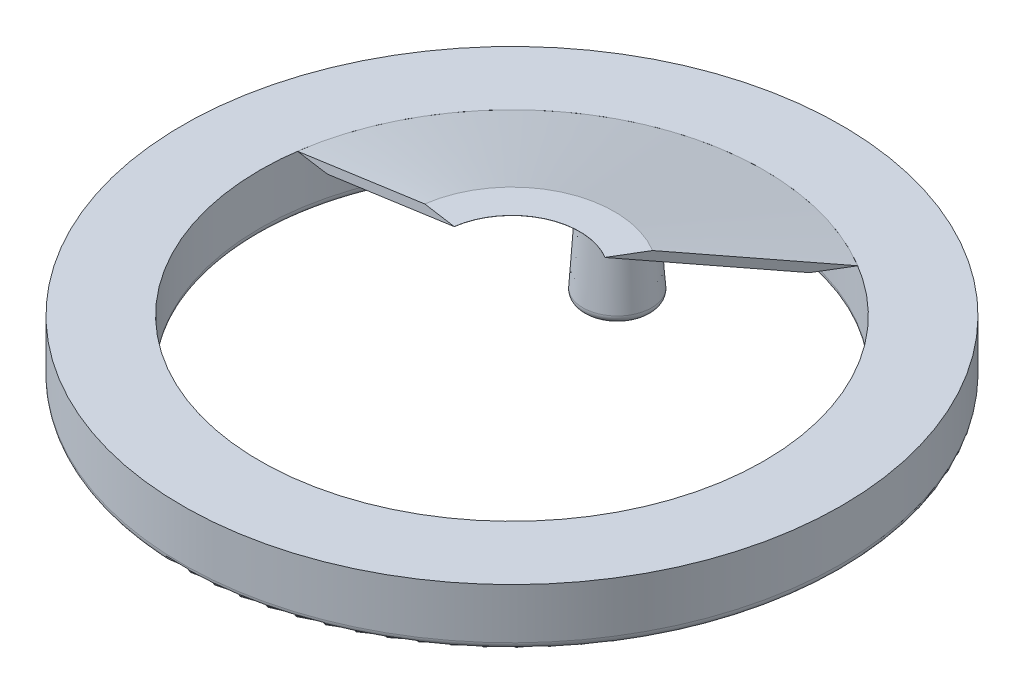
from build123d import *

# Parameters (mm, degrees)
SKETCH1_W                 = 960
SKETCH1_H                 = 450
BOSS_EXTRUDE1_DEPTH       = 118
BOSS_EXTRUDE10_DEPTH      = 10
BOSS_EXTRUDE15_DEPTH      = 30
SWEEP1_PROFILE_R          = 5
SKETCH39_R                = 10
BOSS_EXTRUDE17_DEPTH      = 30
BOSS_EXTRUDE17_DRAFT      = -6
SKETCH290_R               = 48
BOSS_EXTRUDE33_DEPTH      = 10
SKETCH291_R               = 25
CUT_EXTRUDE18_START       = -255
CUT_EXTRUDE18_OUTLINE_R   = 21.000000142
CUT_EXTRUDE18_DEPTH       = 20
BOSS_EXTRUDE34_START      = 10
SKETCH294_R               = 24.999996895
SKETCH294_R_2             = 21.000000142
BOSS_EXTRUDE34_DEPTH      = 10
SKETCH295_R               = 17.5
BOSS_EXTRUDE35_DEPTH      = 40
SKETCH298_R               = 85
SKETCH298_R_2             = 65
BOSS_EXTRUDE36_DEPTH      = 15
REVOLVE2_ANGLE            = 82
REVOLVE2_OTHER_WAY_ANGLE  = 31
SKETCH301_R               = 7
SKETCH302_R               = 9
SKETCH348_R               = 7.85
BOSS_EXTRUDE39_DEPTH      = 25.7
SKETCH349_R               = 25
BOSS_EXTRUDE40_DEPTH      = 20
SKETCH351_R               = 7.85
BOSS_EXTRUDE41_DEPTH      = 25.7
SKETCH353_R               = 25
BOSS_EXTRUDE42_DEPTH      = 20
SKETCH359_W               = 176
SKETCH359_H               = 100
BOSS_EXTRUDE44_DEPTH      = 3
SKETCH360_R               = 15
SKETCH360_R_2             = 20
BOSS_EXTRUDE46_DEPTH      = 8
SKETCH361_R               = 20
BOSS_EXTRUDE47_DEPTH      = 8
SKETCH368_W               = 153
SKETCH368_H               = 100
BOSS_EXTRUDE48_DEPTH      = 3
SKETCH409_W               = 87.321701038
SKETCH409_H               = 70.377876338
CUT_EXTRUDE21_DEPTH       = 202
BOSS_EXTRUDE51_DEPTH      = 8.5
SKETCH417_W               = 25
SKETCH417_H               = 43
BOSS_EXTRUDE52_DEPTH      = 21.3
SKETCH418_W               = 31.239129338
SKETCH418_H               = 19
BOSS_EXTRUDE53_DEPTH      = 7.5
SWEEP4_PROFILE_R          = 5
BOSS_EXTRUDE54_DEPTH      = 450
BOSS_EXTRUDE55_DEPTH      = 450
BOSS_EXTRUDE55_2_DEPTH    = 450
BOSS_EXTRUDE56_DEPTH      = 8
BOSS_EXTRUDE57_DEPTH      = 12
BOSS_EXTRUDE58_DEPTH      = 40
BOSS_EXTRUDE58_DEPTH_BACK = 40
SKETCH523_W               = 30
SKETCH523_H               = 450
SKETCH528_R               = 8
CUT_EXTRUDE23_DEPTH       = 505
CUT_EXTRUDE24_DEPTH       = 31
SKETCH531_R               = 12.5
CUT_EXTRUDE25_DEPTH       = 91
SKETCH532_R               = 9
BOSS_EXTRUDE59_DEPTH      = 11
BOSS_EXTRUDE59_TAPER      = 13
SWEEP5_PROFILE_R          = 3
SKETCH548_R               = 3.822526848
BOSS_EXTRUDE60_DEPTH      = 11
BOSS_EXTRUDE60_DRAFT      = -4
BOSS_EXTRUDE61_DEPTH      = 450
BOSS_EXTRUDE62_DEPTH      = 20
SKETCH574_W               = 6
SKETCH574_H               = 6.933046309
BOSS_EXTRUDE63_DEPTH      = 20
CUT_EXTRUDE26_DEPTH       = 10
SKETCH576_R               = 3.3489074
CUT_EXTRUDE27_DEPTH       = 5
CUT_EXTRUDE28_DEPTH       = 2
BOSS_EXTRUDE64_DEPTH      = 40
BOSS_EXTRUDE64_DEPTH_BACK = 50
SKETCH578_W               = 30
SKETCH578_H               = 450
SKETCH579_R               = 8
CUT_EXTRUDE29_DEPTH       = 458
SKETCH580_R               = 9
BOSS_EXTRUDE65_DEPTH      = 12
BOSS_EXTRUDE65_TAPER      = 9
SWEEP6_PROFILE_R          = 3
SKETCH624_R               = 4
BOSS_EXTRUDE66_DEPTH      = 12
BOSS_EXTRUDE66_DRAFT      = -6
BOSS_EXTRUDE67_DEPTH      = 35
BOSS_EXTRUDE68_DEPTH      = 35
CUT_EXTRUDE31_DEPTH       = 43
CUT_EXTRUDE32_DEPTH       = 600
FILLET1_R                 = 2
FILLET2_R                 = 2


# Read off the part's stored shape, not the designer's step: Boss-Extrude15, Cut-Extrude18
with BuildPart() as part:
    # Sketch1 → Boss-Extrude1 (new body)
    with BuildSketch(Plane.XY):
        Rectangle(SKETCH1_W, SKETCH1_H)
    extrude(amount=BOSS_EXTRUDE1_DEPTH)

    # Sketch27 → Boss-Extrude10 (add)
    with BuildSketch(Plane.XZ.offset(225)):
        with BuildLine():
            Line((-358.776190415, 0), (-290.379824208, 0))
            ThreePointArc((-290.379824208, 0), (-324.578007312, 52.886171467), (-358.776190415, 0))
        make_face()
    extrude(amount=BOSS_EXTRUDE10_DEPTH)

    # Sketch290 → Boss-Extrude33 (add)
    with BuildSketch(Plane.XZ.offset(225)):
        with Locations(Location((412, 58, 0), (0, 0, 90))):
            Circle(SKETCH290_R)
    extrude(amount=BOSS_EXTRUDE33_DEPTH)

    # Sketch291 → section 1 of loft2
    with BuildSketch(Plane(origin=(0, -255, 0), x_dir=(-1, 0, 0), z_dir=(0, -1, 0)), mode=Mode.PRIVATE) as loft2_s1:
        with Locations((-412, -58)):
            Circle(SKETCH291_R)
    # loft from a face of the part (loft2)
    loft([part.faces().sort_by_distance((412, -235, 58))[0], loft2_s1.sketch])

    # Cut-Extrude18 outline → Cut-Extrude18 (cut)
    with BuildSketch(Plane(origin=(0, 0, 0), x_dir=(1, 0, 0), z_dir=(0, 1, 0)).offset(CUT_EXTRUDE18_START)):
        with Locations((412.000003105, -57.99999986)):
            Circle(CUT_EXTRUDE18_OUTLINE_R)
    extrude(amount=CUT_EXTRUDE18_DEPTH, mode=Mode.SUBTRACT)

    # Sketch294 → Boss-Extrude34 (add)
    with BuildSketch(Plane.XZ.offset(255).offset(BOSS_EXTRUDE34_START)):
        with Locations(Location((412.000003105, 57.99999986, 0), (0, 0, 90.000007115))):
            Circle(SKETCH294_R)
        with Locations(Location((412.000003105, 57.99999986, 0), (0, 0, 270))):
            Circle(SKETCH294_R_2, mode=Mode.SUBTRACT)
    extrude(amount=-BOSS_EXTRUDE34_DEPTH)

    # Sketch295 → Boss-Extrude35 (add)
    with BuildSketch(Plane.XZ.offset(235)):
        with Locations(Location((412.000003105, 57.99999986, 0), (0, 0, 90))):
            Circle(SKETCH295_R)
    extrude(amount=BOSS_EXTRUDE35_DEPTH)

    # Sketch299 → Revolve2 (revolve)
    with BuildSketch(Plane(origin=(412, 0, 0), x_dir=(0, 0, -1), z_dir=(1, 0, 0))):
        Polygon((-2.030561419, -285), (-40.49999986, -275.023695571), (-40.49999986, -272.681794182), (7.00000014, -285), align=None)
    revolve(axis=Axis((412.000003105, -275, 57.99999986), (0, 1, 0)), revolution_arc=REVOLVE2_ANGLE)

    # Sketch299 → Revolve2 other way (revolve)
    with BuildSketch(Plane(origin=(412, 0, 0), x_dir=(0, 0, -1), z_dir=(1, 0, 0))):
        Polygon((-2.030561419, -285), (-40.49999986, -275.023695571), (-40.49999986, -272.681794182), (7.00000014, -285), align=None)
    revolve(axis=Axis((412.000003105, -275, 57.99999986), (0, -1, 0)), revolution_arc=REVOLVE2_OTHER_WAY_ANGLE)

    # Sketch348 → Boss-Extrude39 (add)
    with BuildSketch(Plane.XZ.offset(225)):
        with Locations(Location((260, 93, 0), (0, 0, 90))):
            Circle(SKETCH348_R)
    extrude(amount=BOSS_EXTRUDE39_DEPTH)

    # Sketch349 → Boss-Extrude40 (add)
    with BuildSketch(Plane.XZ.offset(250.7)):
        with Locations(Location((260, 93, 0), (0, 0, 270))):
            Circle(SKETCH349_R)
    extrude(amount=BOSS_EXTRUDE40_DEPTH)

    # Sketch351 → Boss-Extrude41 (add)
    with BuildSketch(Plane(origin=(-410.149510752, -225, -12.966274107), x_dir=(1, 0, 0), z_dir=(0, -1, 0))):
        with Locations(Location((201.149510752, 105.966274107, 0), (0, 0, 90))):
            Circle(SKETCH351_R)
    extrude(amount=BOSS_EXTRUDE41_DEPTH)

    # Sketch353 → Boss-Extrude42 (add)
    with BuildSketch(Plane(origin=(-410.149510752, -250.7, -12.966274107), x_dir=(1, 0, 0), z_dir=(0, -1, 0))):
        with Locations(Location((201.149510752, 105.966274107, 0), (0, 0, 270))):
            Circle(SKETCH353_R)
    extrude(amount=BOSS_EXTRUDE42_DEPTH)

    # Sketch359 → Boss-Extrude44 (add)
    with BuildSketch(Plane.XZ.offset(225)):
        with Locations((157, 50)):
            Rectangle(SKETCH359_W, SKETCH359_H)
    extrude(amount=BOSS_EXTRUDE44_DEPTH)

    # Sketch360 → Boss-Extrude46 (add)
    with BuildSketch(Plane.XZ.offset(228)):
        with Locations(Location((200, 45, 0), (0, 0, 90))):
            Circle(SKETCH360_R)
        with Locations(Location((157, 45, 0), (0, 0, 90))):
            Circle(SKETCH360_R)
        with Locations(Location((112, 45, 0), (0, 0, 90))):
            Circle(SKETCH360_R_2)
    extrude(amount=BOSS_EXTRUDE46_DEPTH)

    # Sketch361 → Boss-Extrude47 (add)
    with BuildSketch(Plane.XZ.offset(236)):
        with Locations(Location((112, 45, 0), (0, 0, 90))):
            Circle(SKETCH361_R)
    extrude(amount=BOSS_EXTRUDE47_DEPTH)

    # Sketch368 → Boss-Extrude48 (add)
    with BuildSketch(Plane.XZ.offset(225)):
        with Locations((-22.5, 50)):
            Rectangle(SKETCH368_W, SKETCH368_H)
    extrude(amount=BOSS_EXTRUDE48_DEPTH)


with BuildPart() as body_2:
    # Boss-Extrude15 outline → Boss-Extrude15 (new body)
    with BuildSketch(Plane.XZ.offset(235)):
        with BuildLine():
            Line((-339.578007312, 0), (-309.578007312, 0))
            Line((-309.578007312, 0), (-309.578007312, 49.755489179))
            ThreePointArc((-309.578007312, 49.755489179), (-324.578007312, 52.886171467), (-339.578007312, 49.755489179))
            Line((-339.578007312, 49.755489179), (-339.578007312, 0))
        make_face()
    extrude(amount=BOSS_EXTRUDE15_DEPTH)


with BuildPart() as body_3:
    # Sweep1: sweep along a path in Sketch30
    with BuildLine(Plane(origin=(-324.578007312, 0, 0), x_dir=(0, 0, -1), z_dir=(1, 0, 0))) as sweep1_path:
        Line((-70.098528038, -245), (-166.691110666, -270.88190451))
    # Sweep1 profile (on start of the path) → Sweep1 (sweep)
    with BuildSketch(Plane(origin=(-324.578007312, -245, 70.098528038), x_dir=(0, 0.9659258262890672, 0.25881904510252496), z_dir=(0, -0.25881904510252496, 0.9659258262890672))):
        Circle(SWEEP1_PROFILE_R)
    sweep(path=sweep1_path.line)


with BuildPart() as body_4:
    # Sketch39 → Boss-Extrude17 (with draft: the straight prism first)
    with BuildSketch(Plane(origin=(0, -59.818424556, 223.245399672), x_dir=(1, 0, 0), z_dir=(0, -0.25881904510252496, 0.9659258262890672))):
        with Locations((-324.578007312, -218.508993351)):
            Circle(SKETCH39_R)
    extrude(amount=-BOSS_EXTRUDE17_DEPTH)
    # Boss-Extrude17: the draft: its side faces are tilted about the plane it starts from
    boss_extrude17_sides = [body_4.faces().sort_by_distance(p)[0] for p in [
        (-334.578007312, -266.999618834, 152.202223272),
    ]]
    draft(boss_extrude17_sides, Plane(origin=(0, -59.818424556, 223.245399672), x_dir=(1, 0, 0), z_dir=(0, -0.25881904510252496, 0.9659258262890672)), BOSS_EXTRUDE17_DRAFT)


with BuildPart() as body_5:
    # Sketch298 → Boss-Extrude36 (new body)
    with BuildSketch(Plane(origin=(0, -285, 0), x_dir=(-1, 0, 0), z_dir=(0, -1, 0))):
        with Locations(Location((-412.000003105, -57.99999986, 0), (0, 0, 180))):
            Circle(SKETCH298_R)
        with Locations(Location((-412.000003105, -57.99999986, 0), (0, 0, 180))):
            Circle(SKETCH298_R_2, mode=Mode.SUBTRACT)
    extrude(amount=BOSS_EXTRUDE36_DEPTH)

    # Fillet2
    fillet2_edges = [body_5.edges().sort_by_distance(p)[0] for p in [
        (327.000003105, -300, 57.99999986),
        (347.000003105, -300, 57.99999986),
    ]]
    fillet(fillet2_edges, radius=FILLET2_R)


with BuildPart() as body_6:
    # Sketch301 → Loft3 section 0
    with BuildSketch(Plane.XZ.offset(300)):
        with Locations((375.04379433, -6.111142955)):
            Circle(SKETCH301_R)
    # Sketch302 → Loft3 section 1
    with BuildSketch(Plane(origin=(0, -331.5, 0), x_dir=(-1, 0, 0), z_dir=(0, -1, 0))):
        with Locations((-375.04379433, 6.111142955)):
            Circle(SKETCH302_R)
    loft()

    # Fillet1
    fillet1_edges = [body_6.edges().sort_by_distance(p)[0] for p in [
        (366.04379433, -331.5, -6.111142955),
        (368.04379433, -300, -6.111142955),
    ]]
    fillet(fillet1_edges, radius=FILLET1_R)


with BuildPart() as cut_extrude21_tool:
    # Sketch409 → Cut-Extrude21 (new body)
    with BuildSketch(Plane(origin=(0, 0, 0), x_dir=(-1, 0, 0), z_dir=(0, 0, -1))):
        with Locations((319.57579901, -260.188938169)):
            Rectangle(SKETCH409_W, SKETCH409_H)
    extrude(amount=-CUT_EXTRUDE21_DEPTH)


with BuildPart() as part_1:
    add(part.part)

    # Cut-Extrude21: cut by cut_extrude21_tool
    add(cut_extrude21_tool.part, mode=Mode.SUBTRACT)

    # Sketch416 → Boss-Extrude51 (add)
    with BuildSketch(Plane.XZ.offset(225)):
        with BuildLine():
            Line((-187.333898684, 0), (-120.666101316, 0))
            ThreePointArc((-120.666101316, 0), (-154, 54.678509787), (-187.333898684, 0))
        make_face()
    extrude(amount=BOSS_EXTRUDE51_DEPTH)

    # Sketch417 → Boss-Extrude52 (add)
    with BuildSketch(Plane(origin=(0, -233.5, 0), x_dir=(-1, 0, 0), z_dir=(0, -1, 0))):
        with Locations((154, -23.5)):
            Rectangle(SKETCH417_W, SKETCH417_H)
    extrude(amount=BOSS_EXTRUDE52_DEPTH)

    # Sketch418 → Boss-Extrude53 (add)
    with BuildSketch(Plane(origin=(-141.5, 0, 0), x_dir=(0, 0, -1), z_dir=(1, 0, 0))):
        with Locations((-19.120957381, -243)):
            Rectangle(SKETCH418_W, SKETCH418_H)
    boss_extrude53 = extrude(amount=BOSS_EXTRUDE53_DEPTH)

    # Mirror11: Boss-Extrude53 across plane
    add(boss_extrude53.mirror(Plane(origin=(-154, 0, 0), x_dir=(0, 0, 1), z_dir=(1, 0, 0))))

    # Sweep4: sweep along a path in Sketch419
    with BuildLine(Plane(origin=(-154, 0, 0), x_dir=(0, 0, -1), z_dir=(1, 0, 0))) as sweep4_path:
        Line((-40.004640895, -239.861739097), (-94.16906731, -249.412388869))
    # Sweep4 profile (on start of the path) → Sweep4 (sweep)
    with BuildSketch(Plane(origin=(-154, -239.861739097, 40.004640895), x_dir=(0, 0.9848077530122079, 0.17364817766693108), z_dir=(0, -0.17364817766693108, 0.9848077530122079))):
        Circle(SWEEP4_PROFILE_R)
    sweep(path=sweep4_path.line)


with BuildPart() as body_2_1:
    add(body_2.part)

    # Cut-Extrude21: cut by cut_extrude21_tool
    add(cut_extrude21_tool.part, mode=Mode.SUBTRACT)


with BuildPart() as body_3_1:
    add(body_3.part)

    # Cut-Extrude21: cut by cut_extrude21_tool
    add(cut_extrude21_tool.part, mode=Mode.SUBTRACT)


with BuildPart() as body_4_1:
    add(body_4.part)

    # Cut-Extrude21: cut by cut_extrude21_tool
    add(cut_extrude21_tool.part, mode=Mode.SUBTRACT)


with BuildPart() as body_4_2:
    # Sketch46 → Boss-Extrude54 (new body)
    with BuildSketch(Plane(origin=(0, 225, 0), x_dir=(1, 0, 0), z_dir=(0, 1, 0))):
        Polygon((-309, 134), (-309, 20), (309, 20), (309, 134), (259, 134), (259, 104), (174, 104), (174, 58), (54, 58), (54, 104), (-54, 104), (-54, 88), (-174, 88), (-174, 104), (-259, 104), (-259, 134), align=None)
    extrude(amount=-BOSS_EXTRUDE54_DEPTH)

    # Sketch530 → Cut-Extrude24 (cut)
    with BuildSketch(Plane(origin=(309, 0, 0), x_dir=(0, 0, -1), z_dir=(1, 0, 0))):
        with BuildLine():
            Line((111, -30), (111, 30))
            ThreePointArc((111, 30), (113.928932188, 37.071067812), (121, 40))
            Line((121, 40), (134, 40))
            Line((134, 40), (134, -40))
            Line((134, -40), (121, -40))
            ThreePointArc((121, -40), (113.928932188, -37.071067812), (111, -30))
        make_face()
    cut_extrude24 = extrude(amount=-CUT_EXTRUDE24_DEPTH, mode=Mode.SUBTRACT)

    # Sketch531 → Cut-Extrude25 (cut)
    with BuildSketch(Plane(origin=(309, 0, 0), x_dir=(0, 0, -1), z_dir=(1, 0, 0))):
        with Locations((61, 0)):
            Circle(SKETCH531_R)
    cut_extrude25 = extrude(amount=-CUT_EXTRUDE25_DEPTH, mode=Mode.SUBTRACT)


with BuildPart() as body_5_2:
    # Sketch507 → Boss-Extrude55 (new body)
    with BuildSketch(Plane.XZ.offset(225)):
        Polygon((245.334467639, 0), (245.334467639, -12), (255.334467639, -12), (255.334467639, -20), (309, -20), (309, -11.290670978), (270.334467639, -4.4728944), (260.334467639, -4.4728944), (260.334467639, 0), align=None)
    extrude(amount=-BOSS_EXTRUDE55_DEPTH)


with BuildPart() as body_6_2:
    # Sketch507 → Boss-Extrude55 2 (new body)
    with BuildSketch(Plane.XZ.offset(225)):
        Polygon((-260.334467639, -4.4728944), (-260.334467639, 0), (-245.334467639, 0), (-245.334467639, -12), (-255.334467639, -12), (-255.334467639, -20), (-309, -20), (-309, -11.290670978), (-270.334467639, -4.4728944), align=None)
    extrude(amount=-BOSS_EXTRUDE55_2_DEPTH)


with BuildPart() as body_7:
    # Sketch508 → Boss-Extrude56 (new body)
    with BuildSketch(Plane.XY.offset(-20)):
        with BuildLine():
            Line((203.822710766, -65.327620509), (203.822710766, 225))
            Line((203.822710766, 225), (-203.822710766, 225))
            Line((-203.822710766, 225), (-203.822710766, -65.327620509))
            ThreePointArc((-203.822710766, -65.327620509), (0, -269.150331275), (203.822710766, -65.327620509))
        make_face()
    extrude(amount=BOSS_EXTRUDE56_DEPTH)


with BuildPart() as body_8:
    # Sketch509 → Boss-Extrude57 (new body)
    with BuildSketch(Plane.XY.offset(-12)):
        with BuildLine():
            Line((-223.822710766, 225), (-223.822710766, -65.327620509))
            ThreePointArc((-223.822710766, -65.327620509), (0, -289.150331275), (223.822710766, -65.327620509))
            Line((223.822710766, -65.327620509), (223.822710766, 225))
            Line((223.822710766, 225), (-223.822710766, 225))
        make_face()
    extrude(amount=BOSS_EXTRUDE57_DEPTH)


with BuildPart() as body_9:
    # Sketch523 → Boss-Extrude58 (new, two sides: drawn at the far end of the back side and taken through both)
    with BuildSketch(Plane.ZY.offset(-259).offset(-BOSS_EXTRUDE58_DEPTH_BACK)):
        with Locations((-149, 0)):
            Rectangle(SKETCH523_W, SKETCH523_H)
    extrude(amount=BOSS_EXTRUDE58_DEPTH + BOSS_EXTRUDE58_DEPTH_BACK)

    # Sketch528 → Cut-Extrude23 (cut)
    with BuildSketch(Plane.XZ.offset(225)):
        with Locations(Location((234, -150, 0), (0, 0, 270))):
            Circle(SKETCH528_R)
    extrude(amount=-CUT_EXTRUDE23_DEPTH, mode=Mode.SUBTRACT)


    add(body_4_2.part)  # Boss-Extrude59 merges body 4 2
    # Sketch532 → Boss-Extrude59 (add)
    with BuildSketch(Plane.XY.offset(-134)):
        with Locations((305.731066291, 0)):
            Circle(SKETCH532_R)
    extrude(amount=BOSS_EXTRUDE59_DEPTH, taper=BOSS_EXTRUDE59_TAPER)

    # Sweep5: sweep along a path in Sketch533
    with BuildLine(Plane(origin=(0, 0, 0), x_dir=(1, 0, 0), z_dir=(0, 1, 0))) as sweep5_path:
        Line((308.709235397, 126.778230421), (343.709235397, 126.778230421))
    # Sweep5 profile (on start of the path) → Sweep5 (sweep)
    with BuildSketch(Plane(origin=(308.709235397, 0, -126.778230421), x_dir=(0, 0, 1), z_dir=(1, 0, 0))):
        Circle(SWEEP5_PROFILE_R)
    sweep(path=sweep5_path.line)


with BuildPart() as boss_extrude60_tool:
    # Sketch548 → Boss-Extrude60 (with draft: the straight prism first)
    with BuildSketch(Plane(origin=(343.709235397, 0, 0), x_dir=(0, 0, -1), z_dir=(1, 0, 0))):
        with Locations((126.778230421, 0)):
            Circle(SKETCH548_R)
    extrude(amount=BOSS_EXTRUDE60_DEPTH)
    # Boss-Extrude60: the draft: its side faces are tilted about the plane it starts from
    boss_extrude60_sides = [boss_extrude60_tool.faces().sort_by_distance(p)[0] for p in [
        (349.209235397, 0, -122.955703572),
    ]]
    draft(boss_extrude60_sides, Plane(origin=(343.709235397, 0, 0), x_dir=(0, 0, -1), z_dir=(1, 0, 0)), BOSS_EXTRUDE60_DRAFT)


with BuildPart() as body_9_1:
    add(body_9.part)

    # Boss-Extrude60: add boss_extrude60_tool
    add(boss_extrude60_tool.part)



with BuildPart() as body_9_2:
    # Sketch569 → Boss-Extrude61 (new body)
    with BuildSketch(Plane.XZ.offset(225)):
        Polygon((299, -134), (299, -164), (309, -164), (309, -154), (305, -154), (305, -144), (309, -144), (309, -134), align=None)
    extrude(amount=-BOSS_EXTRUDE61_DEPTH)


with BuildPart() as body_9_3:
    add(body_9_1.part)

    add(body_9_2.part)  # Boss-Extrude62 merges body 9 2
    # Sketch573 → Boss-Extrude62 (add)
    with BuildSketch(Plane(origin=(0, -195, 0), x_dir=(-1, 0, 0), z_dir=(0, -1, 0))):
        with BuildLine():
            Line((-305, 154), (-305, 144))
            Line((-305, 144), (-310, 144))
            Line((-310, 144), (-310, 139))
            Line((-310, 139), (-320, 139))
            Line((-320, 139), (-320, 189))
            Line((-320, 189), (-314, 189))
            Line((-314, 189), (-314, 177.959605655))
            add(Edge.make_bspline(
                [(-314, 177.959605655), (-313.095582929, 173.000040249), (-310, 170.724904616)],
                knots=[0, 0, 0, 0.563388654, 0.563388654, 0.563388654], degree=2))
            Line((-310, 170.724904616), (-310, 154))
            Line((-310, 154), (-305, 154))
        make_face()
    boss_extrude62 = extrude(amount=-BOSS_EXTRUDE62_DEPTH)

    # Sketch574 → Boss-Extrude63 (add)
    with BuildSketch(Plane(origin=(0, -175, 0), x_dir=(1, 0, 0), z_dir=(0, 1, 0))):
        with Locations((317, 185.533476845)):
            Rectangle(SKETCH574_W, SKETCH574_H)
    boss_extrude63 = extrude(amount=BOSS_EXTRUDE63_DEPTH)

    # Sketch575 → Cut-Extrude26 (cut)
    with BuildSketch(Plane(origin=(320, 0, 0), x_dir=(0, 0, -1), z_dir=(1, 0, 0))):
        with BuildLine():
            Line((175.976347761, -190.268278203), (154.440154303, -190.268278203))
            ThreePointArc((154.440154303, -190.268278203), (149.459921424, -185.288045325), (154.440154303, -180.307812446))
            Line((154.440154303, -180.307812446), (175.976347761, -180.307812446))
            ThreePointArc((175.976347761, -180.307812446), (180.95658064, -185.288045325), (175.976347761, -190.268278203))
        make_face()
    cut_extrude26 = extrude(amount=-CUT_EXTRUDE26_DEPTH, mode=Mode.SUBTRACT)

    # Sketch576 → Cut-Extrude27 (cut)
    with BuildSketch(Plane(origin=(320, 0, 0), x_dir=(0, 0, -1), z_dir=(1, 0, 0))):
        with Locations(Location((144.110553228, -185, 0), (0, 0, 90))):
            Circle(SKETCH576_R)
    cut_extrude27 = extrude(amount=-CUT_EXTRUDE27_DEPTH, mode=Mode.SUBTRACT)

    # Sketch577 → Cut-Extrude28 (cut)
    with BuildSketch(Plane(origin=(320, 0, 0), x_dir=(0, 0, -1), z_dir=(1, 0, 0))):
        with BuildLine():
            Line((183.830404245, -189.715609951), (183.830404245, -158.966099244))
            ThreePointArc((183.830404245, -158.966099244), (185.689373715, -157.107129773), (187.548343186, -158.966099244))
            Line((187.548343186, -158.966099244), (187.548343186, -189.715609951))
            ThreePointArc((187.548343186, -189.715609951), (185.689373715, -191.574579422), (183.830404245, -189.715609951))
        make_face()
    cut_extrude28 = extrude(amount=-CUT_EXTRUDE28_DEPTH, mode=Mode.SUBTRACT)

    # Mirror14: Boss-Extrude62, Boss-Extrude63, Cut-Extrude26, Cut-Extrude27, Cut-Extrude28 across plane
    add(boss_extrude62.mirror(Plane.ZX))
    add(boss_extrude63.mirror(Plane.ZX))
    add(cut_extrude26.mirror(Plane.ZX), mode=Mode.SUBTRACT)
    add(cut_extrude27.mirror(Plane.ZX), mode=Mode.SUBTRACT)
    add(cut_extrude28.mirror(Plane.ZX), mode=Mode.SUBTRACT)

    # Mirror22: Cut-Extrude24, Cut-Extrude25 across plane
    add(cut_extrude24.mirror(Plane(origin=(0, 0, 0), x_dir=(0, 0, 1), z_dir=(1, 0, 0))), mode=Mode.SUBTRACT)
    add(cut_extrude25.mirror(Plane(origin=(0, 0, 0), x_dir=(0, 0, 1), z_dir=(1, 0, 0))), mode=Mode.SUBTRACT)



with BuildPart() as body_9_3_1:
    # Sketch578 → Boss-Extrude64 (new, two sides: drawn at the far end of the back side and taken through both)
    with BuildSketch(Plane(origin=(-259, 0, 0), x_dir=(0, 0, -1), z_dir=(1, 0, 0)).offset(-BOSS_EXTRUDE64_DEPTH_BACK)):
        with Locations((149, 0)):
            Rectangle(SKETCH578_W, SKETCH578_H)
    extrude(amount=BOSS_EXTRUDE64_DEPTH + BOSS_EXTRUDE64_DEPTH_BACK)

    # Sketch579 → Cut-Extrude29 (cut)
    with BuildSketch(Plane.XZ.offset(225)):
        with Locations(Location((-233, -150, 0), (0, 0, 270))):
            Circle(SKETCH579_R)
    extrude(amount=-CUT_EXTRUDE29_DEPTH, mode=Mode.SUBTRACT)


with BuildPart() as body_9_4:
    add(body_9_3.part)

    add(body_9_3_1.part)  # Boss-Extrude65 merges body 9 3
    # Sketch580 → Boss-Extrude65 (add)
    with BuildSketch(Plane.XY.offset(-134)):
        with Locations((-293, 0)):
            Circle(SKETCH580_R)
    extrude(amount=BOSS_EXTRUDE65_DEPTH, taper=BOSS_EXTRUDE65_TAPER)

    # Sketch627 → Boss-Extrude67 (add)
    with BuildSketch(Plane.XZ.offset(-40)):
        Polygon((-309, -147.723102329), (-309, -186), (-344, -186), (-344, -218.886191283), (-347, -218.886191283), (-347, -183), (-312, -183), (-312, -147.723102329), align=None)
    extrude(amount=-BOSS_EXTRUDE67_DEPTH)


with BuildPart() as body_9_4_1:
    # Sweep6: sweep along a path in Sketch581
    with BuildLine(Plane(origin=(0, 0, 0), x_dir=(-1, 0, 0), z_dir=(0, -1, 0))) as sweep6_path:
        Line((304.412677424, 128.691302195), (339.34302055, 126.484238737))
    # Sweep6 profile (on start of the path) → Sweep6 (sweep)
    with BuildSketch(Plane(origin=(-304.412677424, 0, -128.691302195), x_dir=(-0.06305895592875901, 0, -0.9980098035977276), z_dir=(-0.9980098035977276, 0, 0.06305895592875901))):
        Circle(SWEEP6_PROFILE_R)
    sweep(path=sweep6_path.line)


with BuildPart() as body_10:
    # Sketch624 → Boss-Extrude66 (with draft: the straight prism first)
    with BuildSketch(Plane(origin=(-330.033555829, 0, 20.853073163), x_dir=(0.06305895592875906, 0, 0.9980098035977277), z_dir=(-0.9980098035977277, 0, 0.06305895592875906))):
        with Locations((-147.631126838, 0)):
            Circle(SKETCH624_R)
    extrude(amount=BOSS_EXTRUDE66_DEPTH)
    # Boss-Extrude66: the draft: its side faces are tilted about the plane it starts from
    boss_extrude66_sides = [body_10.faces().sort_by_distance(p)[0] for p in [
        (-345.583315195, 0, -130.097924216),
    ]]
    draft(boss_extrude66_sides, Plane(origin=(-330.033555829, 0, 20.853073163), x_dir=(0.06305895592875906, 0, 0.9980098035977277), z_dir=(-0.9980098035977277, 0, 0.06305895592875906)), BOSS_EXTRUDE66_DRAFT)


with BuildPart() as body_11:
    # Sketch630 → Boss-Extrude68 (new body)
    with BuildSketch(Plane(origin=(0, 40, 0), x_dir=(-1, 0, 0), z_dir=(0, -1, 0))):
        Polygon((344, 200.467021809), (344, 236.238077684), (292.204421203, 236.238077684), (292.204421203, 233.552235769), (341.841610243, 233.552235769), (341.841610243, 200.467021809), align=None)
    extrude(amount=-BOSS_EXTRUDE68_DEPTH)

    # Sketch633 → Cut-Extrude31 (cut)
    with BuildSketch(Plane.XY.offset(-233.552235769)):
        with BuildLine():
            Line((-305.65, 47.970004875), (-317.75, 47.970004875))
            ThreePointArc((-317.75, 47.970004875), (-320.70603272, 45.013972155), (-317.75, 42.057939435))
            Line((-317.75, 42.057939435), (-305.65, 42.057939435))
            ThreePointArc((-305.65, 42.057939435), (-302.69396728, 45.013972155), (-305.65, 47.970004875))
        make_face()
        with BuildLine():
            Line((-305.65, 64.970004875), (-317.75, 64.970004875))
            ThreePointArc((-317.75, 64.970004875), (-320.70603272, 62.013972155), (-317.75, 59.057939435))
            Line((-317.75, 59.057939435), (-305.65, 59.057939435))
            ThreePointArc((-305.65, 59.057939435), (-302.69396728, 62.013972155), (-305.65, 64.970004875))
        make_face()
    extrude(amount=-CUT_EXTRUDE31_DEPTH, mode=Mode.SUBTRACT)


with BuildPart() as cut_extrude32_tool:
    # Sketch634 → Cut-Extrude32 (new body)
    with BuildSketch(Plane.XY.offset(118)):
        Polygon((-601.593069751, 454.142063996), (593.628576086, 454.142063996), (593.628576086, -275), (188.256947974, -275), (188.256947974, -505.78128578), (-601.593069751, -505.78128578), (-601.593069751, -275), align=None)
    extrude(amount=-CUT_EXTRUDE32_DEPTH)


with BuildPart() as part_2:
    add(part_1.part)

    # Cut-Extrude32: cut by cut_extrude32_tool
    add(cut_extrude32_tool.part, mode=Mode.SUBTRACT)


with BuildPart() as body_5_2_1:
    add(body_5_2.part)

    # Cut-Extrude32: cut by cut_extrude32_tool
    add(cut_extrude32_tool.part, mode=Mode.SUBTRACT)


with BuildPart() as body_6_2_1:
    add(body_6_2.part)

    # Cut-Extrude32: cut by cut_extrude32_tool
    add(cut_extrude32_tool.part, mode=Mode.SUBTRACT)


with BuildPart() as body_7_1:
    add(body_7.part)

    # Cut-Extrude32: cut by cut_extrude32_tool
    add(cut_extrude32_tool.part, mode=Mode.SUBTRACT)


with BuildPart() as body_8_1:
    add(body_8.part)

    # Cut-Extrude32: cut by cut_extrude32_tool
    add(cut_extrude32_tool.part, mode=Mode.SUBTRACT)


with BuildPart() as body_9_5:
    add(body_9_4.part)

    # Cut-Extrude32: cut by cut_extrude32_tool
    add(cut_extrude32_tool.part, mode=Mode.SUBTRACT)


with BuildPart() as body_9_4_2:
    add(body_9_4_1.part)

    # Cut-Extrude32: cut by cut_extrude32_tool
    add(cut_extrude32_tool.part, mode=Mode.SUBTRACT)


with BuildPart() as body_10_1:
    add(body_10.part)

    # Cut-Extrude32: cut by cut_extrude32_tool
    add(cut_extrude32_tool.part, mode=Mode.SUBTRACT)


with BuildPart() as body_11_1:
    add(body_11.part)

    # Cut-Extrude32: cut by cut_extrude32_tool
    add(cut_extrude32_tool.part, mode=Mode.SUBTRACT)


solid = Compound([body_5.part, body_6.part, part_2.part])
